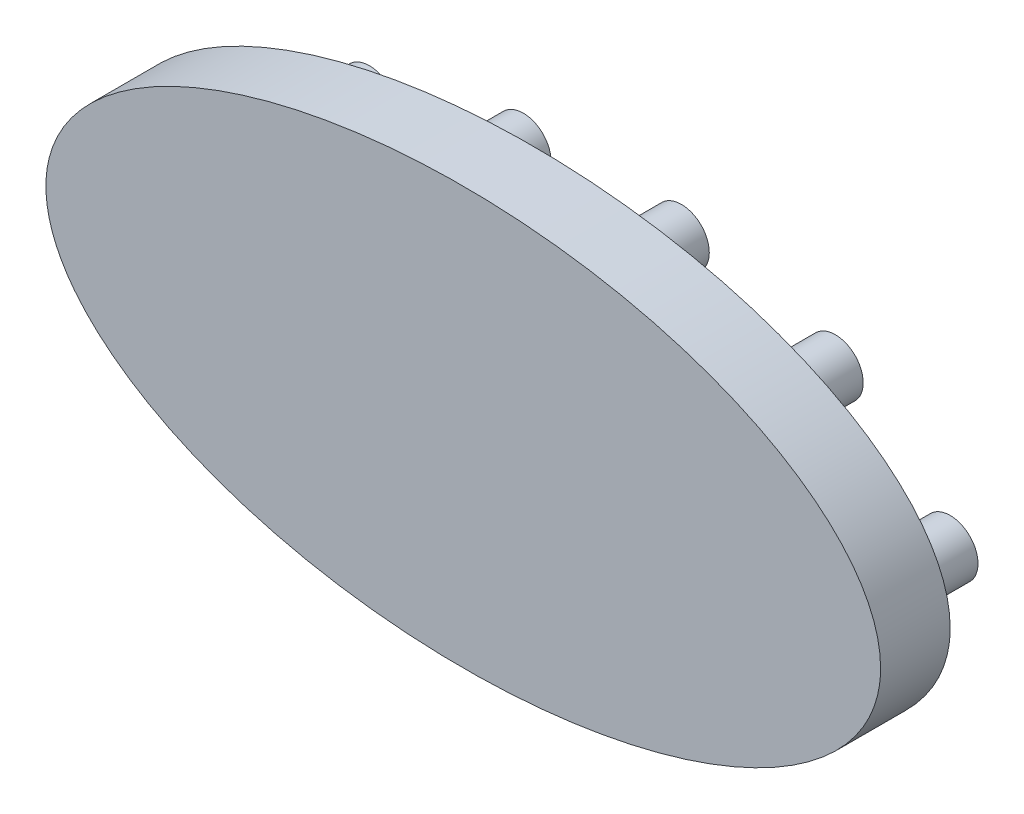
from build123d import *

# Parameters (mm, degrees)
SKICA1_RX               = 60
SKICA1_RY               = 30
SKICA1_R                = 4
P_IDAT_VYSUNUT_M1_DEPTH = 10
SKICA1_4_R              = 4
P_IDAT_VYSUNUT_M3_DEPTH = 10
CRVPATTERN1_START       = -10
CRVPATTERN1_OUTLINE_R   = 4
CRVPATTERN1_DEPTH       = 10


# Read off the part's stored shape, not the designer's step: CrvPattern1
with BuildPart() as part:
    # Skica1 → Přidat vysunutím1 (new body)
    # profile 1 of 2: a face of its own
    with BuildSketch(Plane.XY):
        with Locations((0, 0)):
            Ellipse(SKICA1_RX, SKICA1_RY)
        with Locations((-50, 0)):
            Circle(SKICA1_R, mode=Mode.SUBTRACT)
    # profile 2 of 2: a face of its own
    with BuildSketch(Plane.XY):
        with Locations((-50, 0)):
            Circle(SKICA1_R)
    extrude(amount=P_IDAT_VYSUNUT_M1_DEPTH)

    # Skica1<4> → Přidat vysunutím3 (add)
    with BuildSketch(Plane.XY):
        with Locations((-50, 0)):
            Circle(SKICA1_4_R)
    extrude(amount=-P_IDAT_VYSUNUT_M3_DEPTH)

    # CrvPattern1 outline → CrvPattern1 (add)
    with BuildSketch(Plane.XY.offset(CRVPATTERN1_START)):
        with Locations((-33.492839023, 14.250541881)):
            Circle(CRVPATTERN1_OUTLINE_R)
        with Locations((-11.370922058, 19.405478737)):
            Circle(CRVPATTERN1_OUTLINE_R)
        with Locations((11.370433267, 19.405524946)):
            Circle(CRVPATTERN1_OUTLINE_R)
        with Locations((33.493372943, 14.250403108)):
            Circle(CRVPATTERN1_OUTLINE_R)
        with Locations((49.999827835, -8.0151e-05)):
            Circle(CRVPATTERN1_OUTLINE_R)
        with Locations((33.493062429, -14.250407673)):
            Circle(CRVPATTERN1_OUTLINE_R)
        with Locations((11.369477866, -19.405634054)):
            Circle(CRVPATTERN1_OUTLINE_R)
        with Locations((-11.370751059, -19.405496472)):
            Circle(CRVPATTERN1_OUTLINE_R)
        with Locations((-33.492737691, -14.250555974)):
            Circle(CRVPATTERN1_OUTLINE_R)
    extrude(amount=CRVPATTERN1_DEPTH)


solid = part.part
